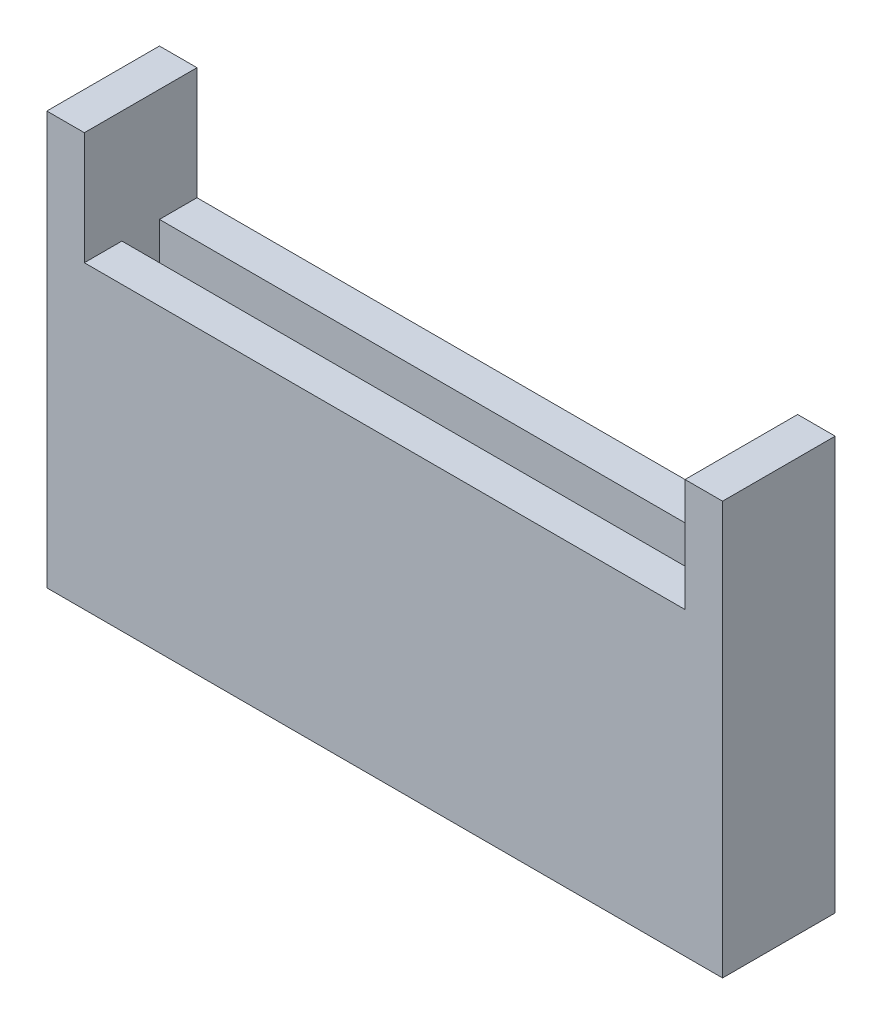
from build123d import *

# Parameters (mm, degrees)
SKETCH1_W             = 1
SKETCH1_H             = 3
BOSS_EXTRUDE1_DEPTH   = 11
BOSS_EXTRUDE1_2_DEPTH = 11
SKETCH1_7_W           = 16
SKETCH1_7_H           = 1
SKETCH1_7_W_2         = 15
BOSS_EXTRUDE2_DEPTH   = 8
BOSS_EXTRUDE3_DEPTH   = 1


with BuildPart() as part:
    # Sketch1 → Boss-Extrude1 (new body)
    with BuildSketch(Plane(origin=(0, 0, 0), x_dir=(1, 0, 0), z_dir=(0, 1, 0))):
        with Locations((-0.5, 1.5)):
            Rectangle(SKETCH1_W, SKETCH1_H)
    extrude(amount=BOSS_EXTRUDE1_DEPTH)



with BuildPart() as body_2:
    # Sketch1 → Boss-Extrude1 2 (new body)
    with BuildSketch(Plane(origin=(0, 0, 0), x_dir=(1, 0, 0), z_dir=(0, 1, 0))):
        with Locations((-17.5, 1.5)):
            Rectangle(SKETCH1_W, SKETCH1_H)
    extrude(amount=BOSS_EXTRUDE1_2_DEPTH)


with BuildPart() as part_1:
    add(part.part)

    add(body_2.part)  # Boss-Extrude2 merges body 2
    # Sketch1<7> → Boss-Extrude2 (add)
    with BuildSketch(Plane(origin=(0, 0, 0), x_dir=(1, 0, 0), z_dir=(0, 1, 0))):
        with Locations((-9, 0.5)):
            Rectangle(SKETCH1_7_W, SKETCH1_7_H)
        with Locations((-9.5, 2.5)):
            Rectangle(SKETCH1_7_W_2, SKETCH1_7_H)
    extrude(amount=BOSS_EXTRUDE2_DEPTH)

    # Sketch1<8> → Boss-Extrude3 (add)
    with BuildSketch(Plane(origin=(0, 0, 0), x_dir=(1, 0, 0), z_dir=(0, 1, 0))):
        Polygon((-17, 1), (-1, 1), (-1, 3), (-2, 3), (-2, 2), (-17, 2), align=None)
    extrude(amount=BOSS_EXTRUDE3_DEPTH)


solid = part_1.part
